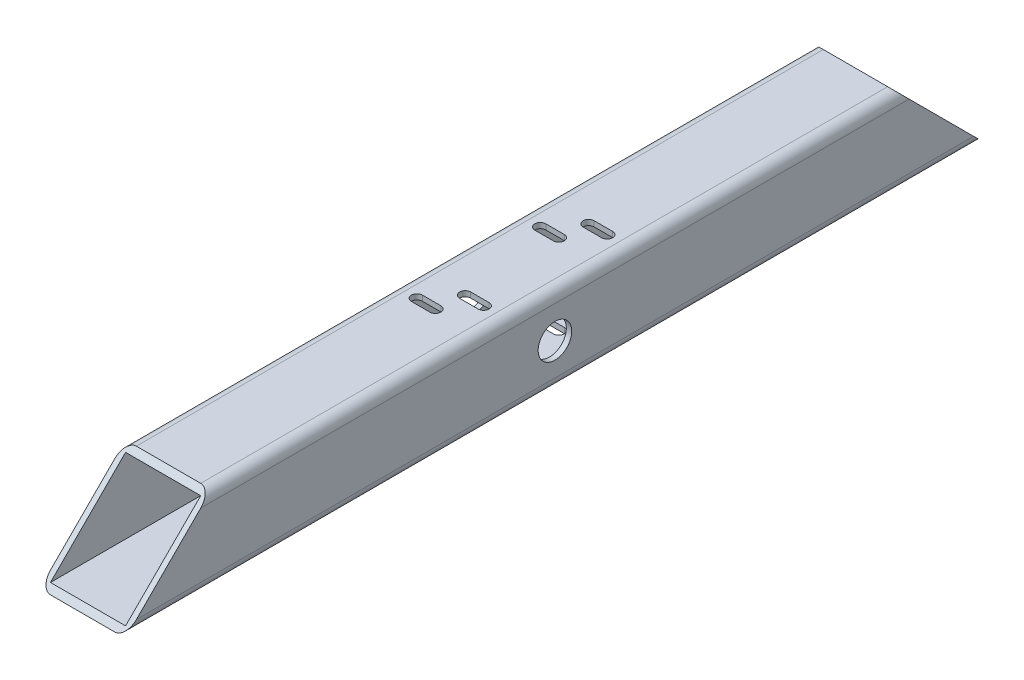
from build123d import *

# Parameters (mm, degrees)
SKETCH1_W                   = 50.8
SKETCH1_H                   = 50.8
SKETCH1_W_2                 = 44.45
SKETCH1_H_2                 = 44.45
BOSS_EXTRUDE1_DEPTH         = 254
FILLET1_R                   = 6.35
CUT_EXTRUDE1_DEPTH          = 914.4
F_1_4_START                 = -25.4
F_1_4_CLEARANCE_SLOT1_DEPTH = 50.8
F_3_4_CLEARANCE_HOLE1_D     = 19.84248


# Read off the part's stored shape, not the designer's step: 1/4 Clearance Slot1
with BuildPart() as part:
    # Sketch1 → Boss-Extrude1 (new, symmetric)
    with BuildSketch(Plane.XY):
        Rectangle(SKETCH1_W, SKETCH1_H)
        Rectangle(SKETCH1_W_2, SKETCH1_H_2, mode=Mode.SUBTRACT)
    extrude(amount=BOSS_EXTRUDE1_DEPTH, both=True)

    # Fillet1
    fillet1_edges = [part.edges().sort_by_distance(p)[0] for p in [
        (-25.4, 25.4, 0),
        (25.4, 25.4, 0),
        (25.4, -25.4, 0),
        (-25.4, -25.4, 0),
    ]]
    fillet(fillet1_edges, radius=FILLET1_R)

    # Sketch2 → Cut-Extrude1 (cut)
    with BuildSketch(Plane.ZY.offset(25.4)):
        Polygon((254, -25.4), (203.2, 25.4), (254, 25.4), align=None)
        Polygon((-254, 25.4), (-254, -25.4), (-203.2, 25.4), align=None)
    extrude(amount=-CUT_EXTRUDE1_DEPTH, mode=Mode.SUBTRACT)

    # 1/4 Clearance Slot1 outline → 1/4 Clearance Slot1 (cut)
    with BuildSketch(Plane(origin=(0, 0, 0), x_dir=(1, 0, 0), z_dir=(0, 1, 0)).offset(F_1_4_START)):
        with BuildLine():
            ThreePointArc((-0.88265, -47.7139), (2.38125, -44.45), (-0.88265, -41.1861))
            Line((-0.88265, -41.1861), (-11.81735, -41.1861))
            ThreePointArc((-11.81735, -41.1861), (-15.08125, -44.45), (-11.81735, -47.7139))
            Line((-11.81735, -47.7139), (-0.88265, -47.7139))
        make_face()
        with BuildLine():
            ThreePointArc((11.81735, -31.8389), (15.08125, -28.575), (11.81735, -25.3111))
            Line((11.81735, -25.3111), (0.88265, -25.3111))
            ThreePointArc((0.88265, -25.3111), (-2.38125, -28.575), (0.88265, -31.8389))
            Line((0.88265, -31.8389), (11.81735, -31.8389))
        make_face()
        with BuildLine():
            ThreePointArc((-0.88265, 25.3111), (2.38125, 28.575), (-0.88265, 31.8389))
            Line((-0.88265, 31.8389), (-11.81735, 31.8389))
            ThreePointArc((-11.81735, 31.8389), (-15.08125, 28.575), (-11.81735, 25.3111))
            Line((-11.81735, 25.3111), (-0.88265, 25.3111))
        make_face()
        with BuildLine():
            Line((0.88265, 41.1861), (11.81735, 41.1861))
            ThreePointArc((11.81735, 41.1861), (15.08125, 44.45), (11.81735, 47.7139))
            Line((11.81735, 47.7139), (0.88265, 47.7139))
            ThreePointArc((0.88265, 47.7139), (-2.38125, 44.45), (0.88265, 41.1861))
        make_face()
    extrude(amount=F_1_4_CLEARANCE_SLOT1_DEPTH, mode=Mode.SUBTRACT)

    # 3/4 Clearance Hole1 (through all)
    with Locations(Plane(origin=(25.4, 0, 0), x_dir=(0, 0, -1), z_dir=(1, 0, 0))):
        with Locations((0, 0)):
            Hole(F_3_4_CLEARANCE_HOLE1_D / 2)


solid = part.part
